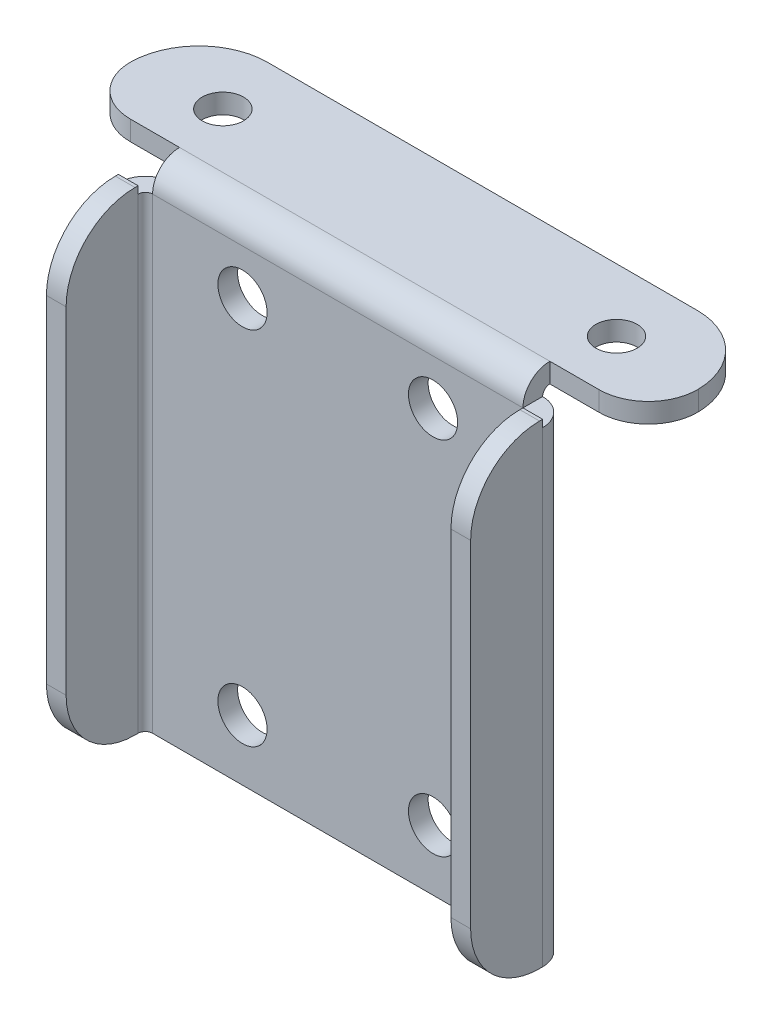
from build123d import *

# Parameters (mm, degrees)
SKETCH6_W                      = 43.1
SKETCH6_H                      = 48.18
SKETCH6_R                      = 2.5
BASE_FLANGE2_DEPTH             = 2
EDGE_FLANGE1_STRIP_W           = 9.4732
EDGE_FLANGE1_STRIP_H           = 2
EDGE_FLANGE1_STRIP_CUT_DEPTH   = 48.18
EDGE_FLANGE1_STRIP_2_W         = 9.4732
EDGE_FLANGE1_STRIP_2_H         = 2
EDGE_FLANGE1_STRIP_CUT_2_DEPTH = 48.18
EDGE_FLANGE1_DEPTH             = 48.18
EDGE_FLANGE1_BEND_DEPTH        = 48.18
EDGE_FLANGE3_DEPTH             = 43.1
EDGE_FLANGE3_2_DEPTH           = 2.7366
EDGE_FLANGE3_START             = 40.3634
EDGE_FLANGE3_3_DEPTH           = 2.7366
EDGE_FLANGE3_START_2           = -7.2634
EDGE_FLANGE3_4_OUTLINE_W       = 2
EDGE_FLANGE3_4_OUTLINE_H       = 11.9634
EDGE_FLANGE3_4_DEPTH           = 57.6268
EDGE_FLANGE3_START_3           = 2.7366
EDGE_FLANGE3_5_DEPTH           = 37.6268
FILLET3_R                      = 7
CUT_EXTRUDE1_REACH             = 74.599
SKETCH21_R                     = 2.1
FILLET4_R                      = 5


# Read off the part's stored shape, not the designer's step: Edge-Flange3
# Sheet-metal steps are written as plain solids
with BuildPart() as part:
    # Sketch6 → Base-Flange2 (new body)
    with BuildSketch(Plane.XY):
        with Locations((21.55, 24.09)):
            Rectangle(SKETCH6_W, SKETCH6_H)
        with Locations((31.23, 6.16)):
            Circle(SKETCH6_R, mode=Mode.SUBTRACT)
        with Locations((11.87, 6.16)):
            Circle(SKETCH6_R, mode=Mode.SUBTRACT)
        with Locations((11.87, 42.83)):
            Circle(SKETCH6_R, mode=Mode.SUBTRACT)
        with Locations((31.23, 42.83)):
            Circle(SKETCH6_R, mode=Mode.SUBTRACT)
    extrude(amount=-BASE_FLANGE2_DEPTH)

    # Edge-Flange1 strip (across the edge) → Edge-Flange1 strip cut (cut)
    with BuildSketch(Plane.XZ.offset(-48.18)):
        with Locations((-2, -1)):
            Rectangle(EDGE_FLANGE1_STRIP_W, EDGE_FLANGE1_STRIP_H)
    extrude(amount=EDGE_FLANGE1_STRIP_CUT_DEPTH, mode=Mode.SUBTRACT)

    # Edge-Flange1 strip 2 (across the edge) → Edge-Flange1 strip cut 2 (cut)
    with BuildSketch(Plane(origin=(43.1, 0, 0), x_dir=(-1, 0, 0), z_dir=(0, 1, 0))):
        with Locations((-2, -1)):
            Rectangle(EDGE_FLANGE1_STRIP_2_W, EDGE_FLANGE1_STRIP_2_H)
    extrude(amount=EDGE_FLANGE1_STRIP_CUT_2_DEPTH, mode=Mode.SUBTRACT)

    # Edge-Flange1 section (across the edge) → Edge-Flange1 (add)
    with BuildSketch(Plane.XZ.offset(-48.18)):
        with BuildLine():
            Line((0, 0.7366), (0, 8.05))
            Line((0, 8.05), (2, 8.05))
            Line((2, 8.05), (2, 0.7366))
            ThreePointArc((2, 0.7366), (2.215745145, 0.215745145), (2.7366, 0))
            Line((2.7366, 0), (2.7366, -2))
            ThreePointArc((2.7366, -2), (0.801531583, -1.198468417), (0, 0.7366))
        make_face()
    extrude(amount=EDGE_FLANGE1_DEPTH)

    # Edge-Flange1 section 2 (across the edge) → Edge-Flange1 bend (add)
    with BuildSketch(Plane(origin=(43.1, 0, 0), x_dir=(-1, 0, 0), z_dir=(0, 1, 0))):
        with BuildLine():
            Line((0, 0.7366), (0, 8.05))
            Line((0, 8.05), (2, 8.05))
            Line((2, 8.05), (2, 0.7366))
            ThreePointArc((2, 0.7366), (2.215745145, 0.215745145), (2.7366, 0))
            Line((2.7366, 0), (2.7366, -2))
            ThreePointArc((2.7366, -2), (0.801531583, -1.198468417), (0, 0.7366))
        make_face()
    extrude(amount=EDGE_FLANGE1_BEND_DEPTH)

    # Edge-Flange3 outline → Edge-Flange3 (cut)
    with BuildSketch(Plane.YZ):
        with BuildLine():
            Line((48.18, 0.7366), (47.4434, 0.7366))
            Line((47.4434, 0.7366), (47.4434, 0))
            ThreePointArc((47.4434, 0), (47.815145906, -0.025366971), (48.18, -0.100997602))
            Line((48.18, -0.100997602), (48.18, 0.7366))
        make_face()
    extrude(amount=EDGE_FLANGE3_DEPTH, mode=Mode.SUBTRACT)

    # Edge-Flange3 2 outline → Edge-Flange3 2 (cut)
    with BuildSketch(Plane.YZ):
        with BuildLine():
            ThreePointArc((48.18, -0.100997602), (47.815145906, -0.025366971), (47.4434, 0))
            Line((47.4434, 0), (47.4434, -2))
            ThreePointArc((47.4434, -2), (47.964254855, -2.215745145), (48.18, -2.7366))
            Line((48.18, -2.7366), (50.18, -2.7366))
            ThreePointArc((50.18, -2.7366), (49.623395312, -1.082332791), (48.18, -0.100997602))
        make_face()
    extrude(amount=EDGE_FLANGE3_2_DEPTH, mode=Mode.SUBTRACT)

    # Edge-Flange3 3 outline → Edge-Flange3 3 (cut)
    with BuildSketch(Plane.YZ.offset(EDGE_FLANGE3_START)):
        with BuildLine():
            ThreePointArc((48.18, -0.100997602), (47.815145906, -0.025366971), (47.4434, 0))
            Line((47.4434, 0), (47.4434, -2))
            ThreePointArc((47.4434, -2), (47.964254855, -2.215745145), (48.18, -2.7366))
            Line((48.18, -2.7366), (50.18, -2.7366))
            ThreePointArc((50.18, -2.7366), (49.623395312, -1.082332791), (48.18, -0.100997602))
        make_face()
    extrude(amount=EDGE_FLANGE3_3_DEPTH, mode=Mode.SUBTRACT)



with BuildPart() as body_2:
    # Edge-Flange3 4 outline → Edge-Flange3 4 (new body)
    with BuildSketch(Plane.YZ.offset(EDGE_FLANGE3_START_2)):
        with Locations((49.18, -8.7183)):
            Rectangle(EDGE_FLANGE3_4_OUTLINE_W, EDGE_FLANGE3_4_OUTLINE_H)
    extrude(amount=EDGE_FLANGE3_4_DEPTH)


with BuildPart() as part_1:
    add(part.part)

    add(body_2.part)  # Edge-Flange3 5 merges body 2
    # Edge-Flange3 5 outline → Edge-Flange3 5 (add)
    with BuildSketch(Plane.YZ.offset(EDGE_FLANGE3_START_3)):
        with BuildLine():
            ThreePointArc((48.18, -0.100997602), (47.815145906, -0.025366971), (47.4434, 0))
            Line((47.4434, 0), (47.4434, -2))
            ThreePointArc((47.4434, -2), (47.964254855, -2.215745145), (48.18, -2.7366))
            Line((48.18, -2.7366), (50.18, -2.7366))
            ThreePointArc((50.18, -2.7366), (49.623395312, -1.082332791), (48.18, -0.100997602))
        make_face()
    extrude(amount=EDGE_FLANGE3_5_DEPTH)

    # Fillet3
    fillet3_edges = [part_1.edges().sort_by_distance(p)[0] for p in [
        (-7.2634, 49.18, -14.7),
        (50.3634, 49.18, -14.7),
        (1, 48.18, 8.05),
        (1, 0, 8.05),
        (42.1, 0, 8.05),
        (42.1, 48.18, 8.05),
    ]]
    fillet(fillet3_edges, radius=FILLET3_R)

    # Sketch21 → Cut-Extrude1 (cut, up to next)
    with BuildSketch(Plane(origin=(0, 50.18, 0), x_dir=(1, 0, 0), z_dir=(0, 1, 0)), mode=Mode.PRIVATE) as cut_extrude1_sk1:
        with Locations(Location((1.55, 8.322080502, 0), (0, 0, 270))):
            Circle(SKETCH21_R)
    cut_extrude1_tool1 = extrude(cut_extrude1_sk1.sketch, amount=-CUT_EXTRUDE1_REACH, mode=Mode.PRIVATE) & part_1.part
    # Sketch21 → Cut-Extrude1 (cut, up to next)
    with BuildSketch(Plane(origin=(0, 50.18, 0), x_dir=(1, 0, 0), z_dir=(0, 1, 0)), mode=Mode.PRIVATE) as cut_extrude1_sk2:
        with Locations(Location((41.55, 8.322080502, 0), (0, 0, 270))):
            Circle(SKETCH21_R)
    cut_extrude1_tool2 = extrude(cut_extrude1_sk2.sketch, amount=-CUT_EXTRUDE1_REACH, mode=Mode.PRIVATE) & part_1.part
    add(cut_extrude1_tool1.solids().sort_by_distance((1.55, 50.18, -8.322081))[0], mode=Mode.SUBTRACT)
    add(cut_extrude1_tool2.solids().sort_by_distance((41.55, 50.18, -8.322081))[0], mode=Mode.SUBTRACT)

    # Fillet4
    fillet4_edges = [part_1.edges().sort_by_distance(p)[0] for p in [
        (50.3634, 49.18, -2.7366),
        (-7.2634, 49.18, -2.7366),
    ]]
    fillet(fillet4_edges, radius=FILLET4_R)


solid = part_1.part
